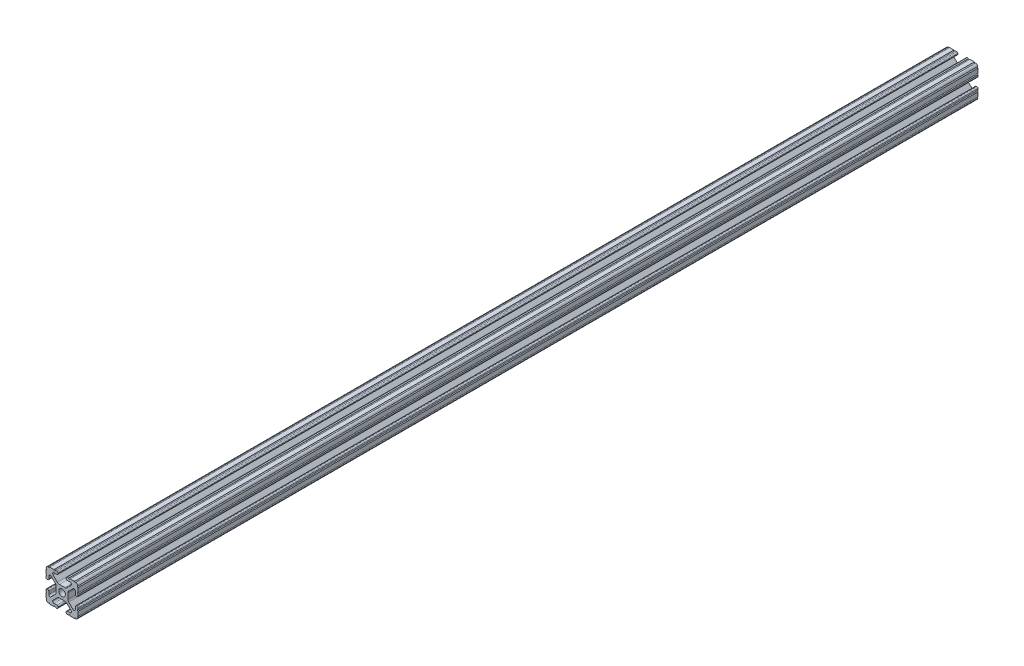
from build123d import *

# Parameters (mm, degrees)
BOSS_EXTRUDE1_DEPTH     = 1524
CUT_EXTRUDE1_DEPTH      = 1525.105829659
CUT_EXTRUDE1_DEPTH_BACK = 1525.105829659
SKETCH5_R               = 0.55245
CUT_EXTRUDE2_DEPTH      = 1525.105829659
CUT_EXTRUDE2_DEPTH_BACK = 1525.105829659
SKETCH8_W               = 50.559993734
SKETCH8_H               = 1231.9
CUT_EXTRUDE3_DEPTH      = 1525.105829659
CUT_EXTRUDE3_DEPTH_BACK = 1525.105829659
SKETCH9_W               = 50.679996867
SKETCH9_H               = 1130.3


with BuildPart() as part:
    # Sketch4 → Boss-Extrude1 (new, symmetric)
    with BuildSketch(Plane.XY):
        with BuildLine():
            Line((4.190365, -12.7), (10.11729625, -12.7))
            ThreePointArc((10.11729625, -12.7), (11.943543585, -11.943543585), (12.7, -10.11729625))
            Line((12.7, -10.11729625), (12.7, -4.190365))
            ThreePointArc((12.7, -4.190365), (12.42492494, -3.52627506), (11.760835, -3.2512))
            Line((11.760835, -3.2512), (11.429365, -3.2512))
            ThreePointArc((11.429365, -3.2512), (10.76527506, -3.52627506), (10.4902, -4.190365))
            Line((10.4902, -4.190365), (10.4902, -6.348478019))
            ThreePointArc((10.4902, -6.348478019), (9.830707141, -7.335478831), (8.666460301, -7.103895736))
            Line((8.666460301, -7.103895736), (5.299899128, -3.737334563))
            ThreePointArc((5.299899128, -3.737334563), (4.817571085, -3.015479634), (4.6482, -2.16399369))
            Line((4.6482, -2.16399369), (4.6482, 0))
            Line((4.6482, 0), (2.6035, 0))
            ThreePointArc((2.6035, 0), (1.840952505, -1.840952505), (0, -2.6035))
            Line((0, -2.6035), (0, -4.6482))
            Line((0, -4.6482), (2.16399369, -4.6482))
            ThreePointArc((2.16399369, -4.6482), (3.015479634, -4.817571085), (3.737334563, -5.299899128))
            Line((3.737334563, -5.299899128), (7.103895736, -8.666460301))
            ThreePointArc((7.103895736, -8.666460301), (7.335478831, -9.830707141), (6.348478019, -10.4902))
            Line((6.348478019, -10.4902), (4.190365, -10.4902))
            ThreePointArc((4.190365, -10.4902), (3.52627506, -10.76527506), (3.2512, -11.429365))
            Line((3.2512, -11.429365), (3.2512, -11.760835))
            ThreePointArc((3.2512, -11.760835), (3.52627506, -12.42492494), (4.190365, -12.7))
        make_face()
    extrude(amount=BOSS_EXTRUDE1_DEPTH, both=True)

    # Sketch5 → Cut-Extrude1 (cut, two sides: drawn at the far end of the back side and taken through both)
    with BuildSketch(Plane.XY.offset(-CUT_EXTRUDE1_DEPTH_BACK)):
        with Locations((10.356153152, -12.7)):
            Circle(SKETCH5_R)
        with Locations((5.796028019, -12.7)):
            Circle(SKETCH5_R)
        with Locations((12.7, -10.356153152)):
            Circle(SKETCH5_R)
        with Locations((12.7, -5.796028019)):
            Circle(SKETCH5_R)
    extrude(amount=CUT_EXTRUDE1_DEPTH + CUT_EXTRUDE1_DEPTH_BACK, mode=Mode.SUBTRACT)

    # Mirror1: part across plane


with BuildPart() as part_1:
    add(part.part)
    add(part.part.mirror(Plane(origin=(0, 0, 0), x_dir=(0, 0, 1), z_dir=(1, 0, 0))))

    # Mirror2: part across plane


with BuildPart() as part_2:
    add(part_1.part)
    add(part_1.part.mirror(Plane.ZX))

    # Sketch8 → Cut-Extrude2 (cut, two sides: drawn at the far end of the back side and taken through both)
    with BuildSketch(Plane(origin=(0, 0, 0), x_dir=(1, 0, 0), z_dir=(0, 1, 0)).offset(-CUT_EXTRUDE2_DEPTH_BACK)):
        with Locations((0, 920.75)):
            Rectangle(SKETCH8_W, SKETCH8_H)
    extrude(amount=CUT_EXTRUDE2_DEPTH + CUT_EXTRUDE2_DEPTH_BACK, mode=Mode.SUBTRACT)

    # Sketch9 → Cut-Extrude3 (cut, two sides: drawn at the far end of the back side and taken through both)
    with BuildSketch(Plane(origin=(0, 0, 0), x_dir=(1, 0, 0), z_dir=(0, 1, 0)).offset(-CUT_EXTRUDE3_DEPTH_BACK)):
        with Locations((-0.060001567, -247.65)):
            Rectangle(SKETCH9_W, SKETCH9_H)
    extrude(amount=CUT_EXTRUDE3_DEPTH + CUT_EXTRUDE3_DEPTH_BACK, mode=Mode.SUBTRACT)


solid = part_2.part
